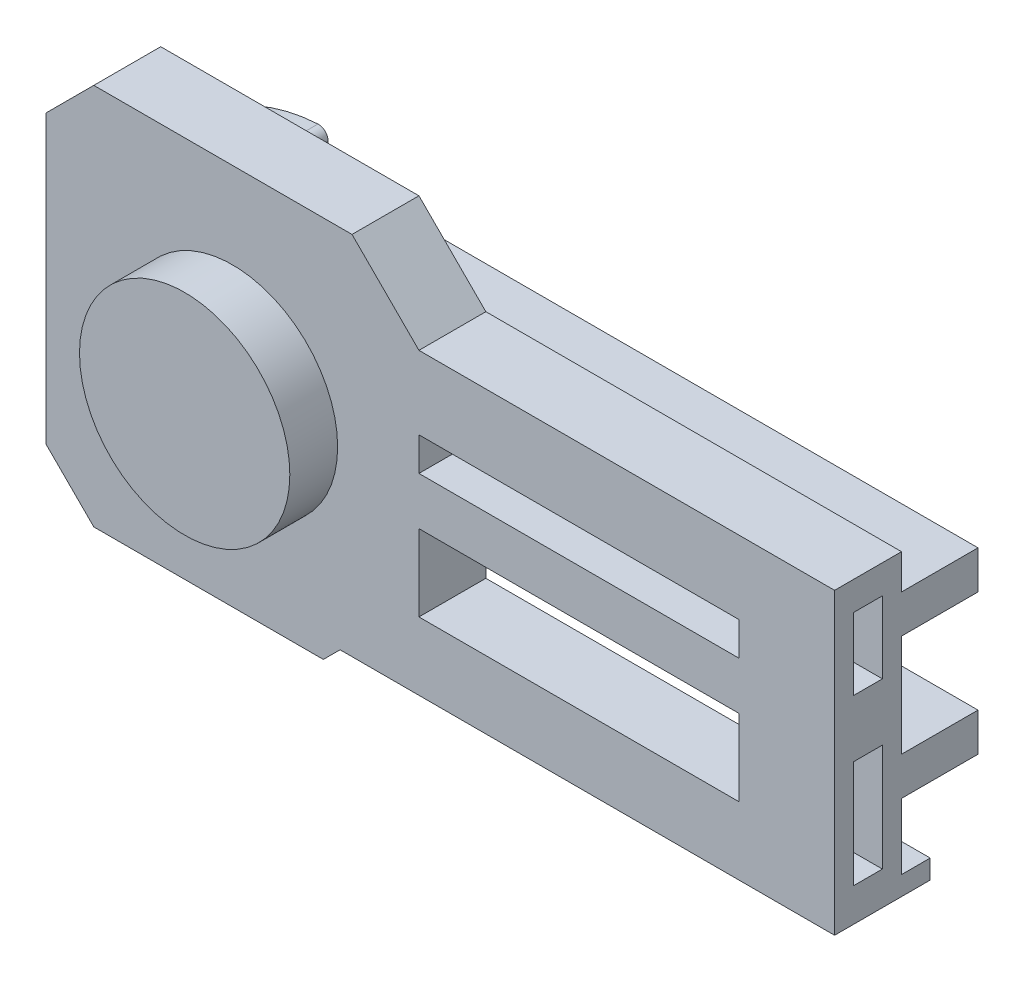
from build123d import *

# Parameters (mm, degrees)
SKETCH1_R               = 5.35
BOSS_EXTRUDE2_DEPTH     = 7
BOSS_EXTRUDE3_START     = 8
SKETCH3_R               = 5.35
BOSS_EXTRUDE3_DEPTH     = 8
BOSS_EXTRUDE4_DEPTH     = 3
FILLET1_R               = 1
CHAMFER1_SIZE           = 10
CHAMFER2_SIZE           = 5
CUT_EXTRUDE1_DEPTH      = 67.560662475
CUT_EXTRUDE1_DEPTH_BACK = 67.560662475
SKETCH5_W               = 33.474956737
SKETCH5_H               = 3.5
SKETCH5_H_2             = 8
CHAMFER3_SIZE           = 7
SKETCH6_R               = 11
BOSS_EXTRUDE5_DEPTH     = 5
SKETCH8_W               = 3
SKETCH8_H               = 7.519820499
SKETCH8_H_2             = 11.230179501
CUT_EXTRUDE2_DEPTH      = 5


# Some blends are built 0.0001 mm under size
with BuildPart() as part:
    # Sketch1 → Boss-Extrude2 (new body)
    with BuildSketch(Plane.XY):
        Polygon((-19.503784034, -20), (19.503784034, -20), (19.503784034, -18.25), (62.978740771, -18.25), (62.978740771, 13), (19.503784034, 13), (19.503784034, 20), (-19.503784034, 20), align=None)
        Circle(SKETCH1_R, mode=Mode.SUBTRACT)
    extrude(amount=-BOSS_EXTRUDE2_DEPTH)

    # Sketch3 → Boss-Extrude3 (add)
    with BuildSketch(Plane.XY.offset(BOSS_EXTRUDE3_START)):
        with BuildLine():
            Line((7.668115805, 5.35), (62.978740771, 5.35))
            Line((62.978740771, 5.35), (62.978740771, 9.35))
            Line((62.978740771, 9.35), (0, 9.35))
            ThreePointArc((0, 9.35), (-9.35, 0), (0, -9.35))
            Line((0, -9.35), (62.978740771, -9.35))
            Line((62.978740771, -9.35), (62.978740771, -5.35))
            Line((62.978740771, -5.35), (7.668115805, -5.35))
            ThreePointArc((7.668115805, -5.35), (9.35, 0), (7.668115805, 5.35))
        make_face()
        Circle(SKETCH3_R, mode=Mode.SUBTRACT)
    extrude(amount=-BOSS_EXTRUDE3_DEPTH)

    # Sketch4 → Boss-Extrude4 (add)
    with BuildSketch(Plane.XY):
        with BuildLine():
            Line((0, -18.25), (62.978740771, -18.25))
            Line((62.978740771, -18.25), (62.978740771, -16.25))
            Line((62.978740771, -16.25), (8.306623863, -16.25))
            Line((8.306623863, -16.25), (0, -16.25))
            ThreePointArc((0, -16.25), (-16.25, 0), (0, 16.25))
            Line((0, 16.25), (0, 18.25))
            ThreePointArc((0, 18.25), (-18.25, 0), (0, -18.25))
        make_face()
    extrude(amount=BOSS_EXTRUDE4_DEPTH)

    # Fillet1
    fillet1_edges = [part.edges().sort_by_distance(p)[0] for p in [
        (0, 16.25, 1.5),
        (0, 18.25, 1.5),
    ]]
    fillet(fillet1_edges, radius=FILLET1_R - 0.0001)  # a hair under: the kernel refuses the full size

    # Chamfer1
    # the kernel refuses this chamfer: 10 mm, written as the material it takes off along each edge
    with BuildSketch(Plane(origin=(19.503784034, -20, 25.71682988), x_dir=(0.027495876610586317, 0.9996219169112968, 0), z_dir=(0, 0, -1))) as chamfer1_piece_1_section:
        Polygon((CHAMFER1_SIZE * 0.999621916911, -CHAMFER1_SIZE * 0.0274958766106), (-CHAMFER1_SIZE * 0.0274958766106, -CHAMFER1_SIZE * 0.999621916911), (0, 0), align=None)
    chamfer1_piece_1 = extrude(amount=58.433659759, mode=Mode.PRIVATE)
    chamfer1_piece_1 = split(chamfer1_piece_1, bisect_by=Plane(origin=(14.814200223, -18.25, -3.5), z_dir=(0, -1, 0)), keep=Keep.TOP, mode=Mode.PRIVATE)
    add(chamfer1_piece_1, mode=Mode.SUBTRACT)

    # Chamfer2
    chamfer2_edges = [part.edges().sort_by_distance(p)[0] for p in [
        (-19.503784034, -20, -3.5),
        (-19.503784034, 20, -3.5),
    ]]
    chamfer(chamfer2_edges, length=CHAMFER2_SIZE)

    # Sketch5 → Cut-Extrude1 (cut, two sides: drawn at the far end of the back side and taken through both)
    with BuildSketch(Plane.XY.offset(-CUT_EXTRUDE1_DEPTH_BACK)):
        with Locations((36.241262403, 3.6)):
            Rectangle(SKETCH5_W, SKETCH5_H)
        with Locations((36.241262403, -7.15)):
            Rectangle(SKETCH5_W, SKETCH5_H_2)
    extrude(amount=CUT_EXTRUDE1_DEPTH + CUT_EXTRUDE1_DEPTH_BACK, mode=Mode.SUBTRACT)

    # Chamfer3
    chamfer3_edges = [part.edges().sort_by_distance(p)[0] for p in [
        (19.503784034, 20, -3.5),
    ]]
    chamfer(chamfer3_edges, length=CHAMFER3_SIZE - 0.0001)  # a hair under: the kernel refuses the full size


with BuildPart() as body_2:
    # Mirror9: mirrored copy
    add(part.part.mirror(Plane.XY.offset(-10)))

    # Sketch6 → Boss-Extrude5 (add)
    with BuildSketch(Plane.XY.offset(-13)):
        Circle(SKETCH6_R)
    extrude(amount=BOSS_EXTRUDE5_DEPTH)

    # Sketch8 → Cut-Extrude2 (cut)
    with BuildSketch(Plane(origin=(62.978740771, 0, 0), x_dir=(0, 0, -1), z_dir=(1, 0, 0))):
        with Locations((16.5, 6.240089751)):
            Rectangle(SKETCH8_W, SKETCH8_H)
        with Locations((16.5, -9.13491025)):
            Rectangle(SKETCH8_W, SKETCH8_H_2)
    extrude(amount=-CUT_EXTRUDE2_DEPTH, mode=Mode.SUBTRACT)


solid = body_2.part
